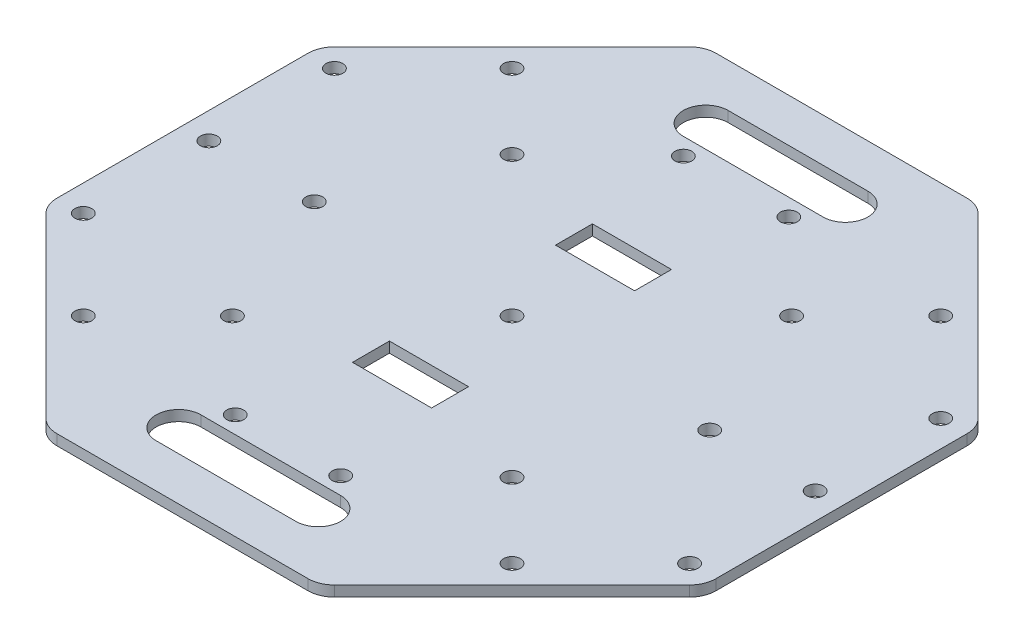
from build123d import *

# Parameters (mm, degrees)
SKETCH1_R           = 1.6
SKETCH1_W           = 15
SKETCH1_H           = 7
BOSS_EXTRUDE1_DEPTH = 2
FILLET1_R           = 5
SKETCH2_R           = 1.6
CUT_EXTRUDE1_DEPTH  = 89.41097217


with BuildPart() as part:
    # Sketch1 → Boss-Extrude1 (new body)
    with BuildSketch(Plane(origin=(0, 0, 0), x_dir=(1, 0, 0), z_dir=(0, 1, 0))):
        Polygon((62.5, -25.888347648), (62.5, 25.888347648), (25.888347648, 62.5), (-25.888347648, 62.5), (-62.5, 25.888347648), (-62.5, -25.888347648), (-25.888347648, -62.5), (25.888347648, -62.5), align=None)
        with Locations((-10, -42.5)):
            Circle(SKETCH1_R, mode=Mode.SUBTRACT)
        with BuildLine():
            ThreePointArc((13.25, -45.75), (17.5, -50), (13.25, -54.25))
            Line((13.25, -54.25), (-13.25, -54.25))
            ThreePointArc((-13.25, -54.25), (-17.5, -50), (-13.25, -45.75))
            Line((-13.25, -45.75), (13.25, -45.75))
        make_face(mode=Mode.SUBTRACT)
        with Locations((10, -42.5)):
            Circle(SKETCH1_R, mode=Mode.SUBTRACT)
        with Locations((0, -19.25)):
            Rectangle(SKETCH1_W, SKETCH1_H, mode=Mode.SUBTRACT)
        with Locations((-10, 42.5)):
            Circle(SKETCH1_R, mode=Mode.SUBTRACT)
        with Locations((0, 19.25)):
            Rectangle(SKETCH1_W, SKETCH1_H, mode=Mode.SUBTRACT)
        with BuildLine():
            Line((-13.25, 54.25), (13.25, 54.25))
            ThreePointArc((13.25, 54.25), (17.5, 50), (13.25, 45.75))
            Line((13.25, 45.75), (-13.25, 45.75))
            ThreePointArc((-13.25, 45.75), (-17.5, 50), (-13.25, 54.25))
        make_face(mode=Mode.SUBTRACT)
        with Locations((10, 42.5)):
            Circle(SKETCH1_R, mode=Mode.SUBTRACT)
    extrude(amount=BOSS_EXTRUDE1_DEPTH)

    # Fillet1
    fillet1_edges = [part.edges().sort_by_distance(p)[0] for p in [
        (-25.888347648, 1, 62.5),
        (-62.5, 1, 25.888347648),
        (-62.5, 1, -25.888347648),
        (-25.888347648, 1, -62.5),
        (25.888347648, 1, -62.5),
        (62.5, 1, -25.888347648),
        (62.5, 1, 25.888347648),
        (25.888347648, 1, 62.5),
    ]]
    fillet(fillet1_edges, radius=FILLET1_R)

    # Sketch2 → Cut-Extrude1 (cut, through all)
    with BuildSketch(Plane(origin=(0, 2, 0), x_dir=(1, 0, 0), z_dir=(0, 1, 0))):
        with Locations((57.5, 0)):
            Circle(SKETCH2_R)
        with Locations((40.658639918, -40.658639918)):
            Circle(SKETCH2_R)
        with Locations((-40.658639918, -40.658639918)):
            Circle(SKETCH2_R)
        with Locations((-57.5, 0)):
            Circle(SKETCH2_R)
        with Locations((-40.658639918, 40.658639918)):
            Circle(SKETCH2_R)
        with Locations((40.658639918, 40.658639918)):
            Circle(SKETCH2_R)
        Circle(SKETCH2_R)
        with Locations((37.5, 0)):
            Circle(SKETCH2_R)
        with Locations((26.516504294, -26.516504294)):
            Circle(SKETCH2_R)
        with Locations((-26.516504294, -26.516504294)):
            Circle(SKETCH2_R)
        with Locations((-37.5, 0)):
            Circle(SKETCH2_R)
        with Locations((-26.516504294, 26.516504294)):
            Circle(SKETCH2_R)
        with Locations((26.516504294, 26.516504294)):
            Circle(SKETCH2_R)
        with Locations((57.5, 23.817279836)):
            Circle(SKETCH2_R)
        with Locations((57.5, -23.817279836)):
            Circle(SKETCH2_R)
        with Locations((-57.5, -23.817279836)):
            Circle(SKETCH2_R)
        with Locations((-57.5, 23.817279836)):
            Circle(SKETCH2_R)
    extrude(amount=-CUT_EXTRUDE1_DEPTH, mode=Mode.SUBTRACT)


solid = part.part
